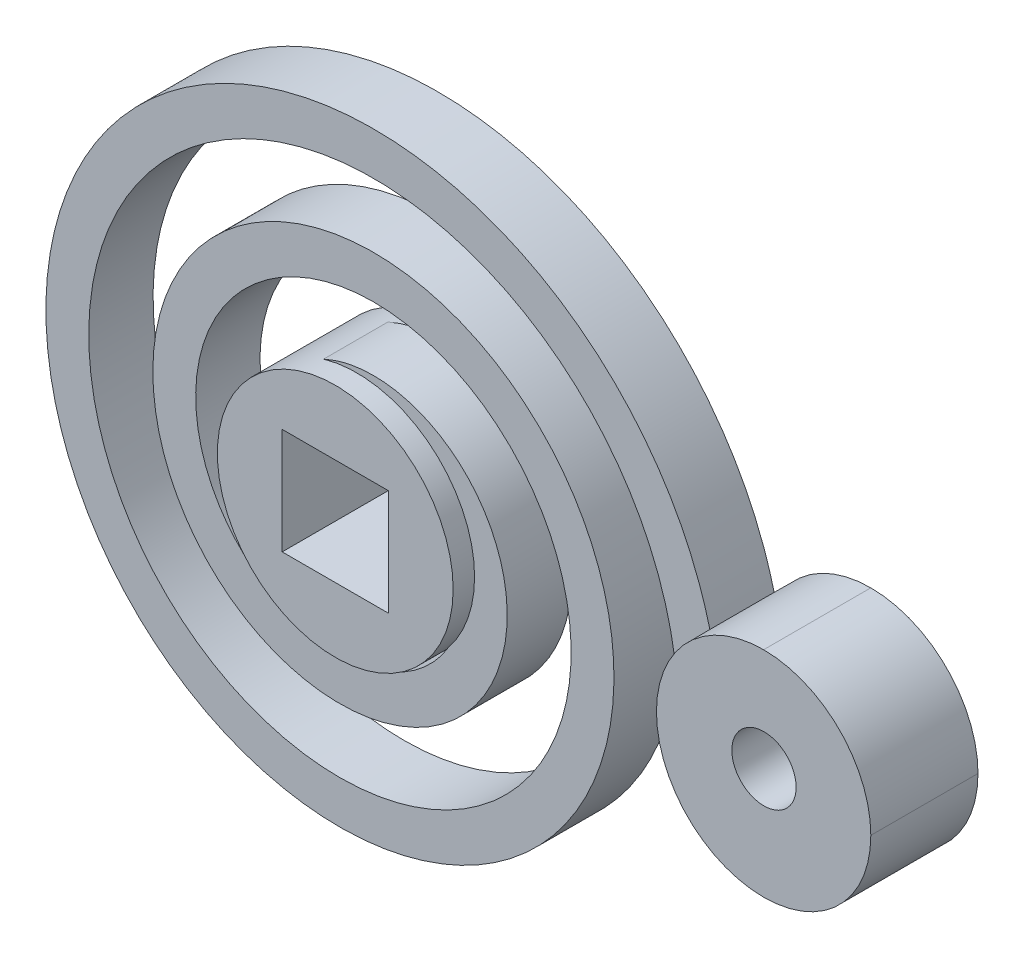
from build123d import *

# Parameters (mm, degrees)
BALAYAGE1_START  = -3
BALAYAGE1_DEPTH  = 3
ESQUISSE5_W      = 2
ESQUISSE5_H      = 3
EXTRUSION1_DEPTH = 4
ESQUISSE8_R      = 5.5
ESQUISSE8_W      = 10
ESQUISSE8_H      = 10
EXTRUSION2_DEPTH = 3
ESQUISSE9_R      = 1.5
ESQUISSE9_W      = 4.949747468
ESQUISSE9_H      = 4.949747468
EXTRUSION3_DEPTH = 30.683713673
EXTRUSION4_START = 1
ESQUISSE10_R     = 5.5
ESQUISSE10_W     = 4.949747468
ESQUISSE10_H     = 4.949747468
ESQUISSE10_W_2   = 10
ESQUISSE10_H_2   = 10
ESQUISSE10_R_2   = 1.5
EXTRUSION4_DEPTH = 1
ESQUISSE11_R     = 5.5
ESQUISSE11_W     = 4.949747468
ESQUISSE11_H     = 4.949747468
ESQUISSE11_W_2   = 10
ESQUISSE11_H_2   = 10
ESQUISSE11_R_2   = 1.5
EXTRUSION5_DEPTH = 1
CONG_1_START     = -4
CONG_1_DEPTH     = 5
CONG_1_2_DEPTH   = 1
CONG_1_3_DEPTH   = 1


with BuildPart() as part:
    # Balayage1: read off the stored shape, not the designer's step
    # Balayage1 outline → Balayage1 (new body)
    with BuildSketch(Plane.XY.offset(BALAYAGE1_START)):
        with BuildLine():
            Line((2.098663599, -0.46176203), (0.123522615, -0.776115481))
            add(Edge.make_bspline(
                [(0.123522615, -0.776115481), (0.119570945, -0.779541607), (0.116841063, -0.801624896), (0.0975614, -0.85668256), (0.079206465, -0.900433427), (0.019116685, -0.990384752), (-0.027528733, -1.045673964), (-0.148833871, -1.145674178), (-0.230781439, -1.197271691), (-0.421065415, -1.275060008), (-0.538243323, -1.305436912), (-0.790758643, -1.326771744), (-0.935598067, -1.31897245), (-1.229220073, -1.253335884), (-1.387268782, -1.193813973), (-1.688620492, -1.019723711), (-1.840120777, -0.900805212), (-2.107459984, -0.610094385), (-2.229719765, -0.431764496), (-2.418157895, -0.032288199), (-2.488450517, 0.196934301), (-2.555911758, 0.680543462), (-2.554573079, 0.943782939), (-2.467802028, 1.47147721), (-2.381161243, 1.744752711), (-2.121060571, 2.26448101), (-1.943848091, 2.518935205), (-1.509479191, 2.971801175), (-1.246401147, 3.176695335), (-0.657106892, 3.503349942), (-0.323357379, 3.62951923), (0.381344739, 3.777117066), (0.760753461, 3.800516307), (1.523625971, 3.729473328), (1.915709359, 3.634417198), (2.666460941, 3.324195536), (3.033148633, 3.105912639), (3.694926531, 2.55912899), (3.996734086, 2.225306189), (4.493840621, 1.469608999), (4.693974098, 1.040695902), (4.960043765, 0.128070209), (5.028521057, -0.363764724), (5.014307751, -1.360347881), (4.931658241, -1.873580254), (4.61158103, -2.865975608), (4.371707666, -3.353237249), (3.748391318, -4.245935559), (3.360245987, -4.658377544), (2.46646316, -5.357619951), (1.95429181, -5.649724951), (0.851952915, -6.073057278), (0.254001961, -6.207433387), (-0.969875767, -6.292747761), (-1.604148351, -6.244414658), (-2.844256393, -5.957530752), (-3.458267977, -5.717236422), (-4.600076718, -5.057175697), (-5.135167071, -4.633357133), (-6.065467866, -3.634654225), (-6.466455902, -3.053772655), (-7.084407032, -1.78543258), (-7.305134435, -1.090562799), (-7.532746496, 0.34841253), (-7.541061918, 1.100691911), (-7.332063144, 2.588948779), (-7.113730208, 3.33314777), (-6.459862064, 4.737214154), (-6.020956025, 5.404634726), (-4.954957034, 6.590878731), (-4.322442528, 7.115931984), (-2.917267116, 7.963174424), (-2.137612246, 8.289732511), (-0.501776106, 8.701331307), (0.362358472, 8.788506009), (2.093045811, 8.702728757), (2.967817072, 8.529497227), (4.641513018, 7.927111256), (5.448206615, 7.495295061), (6.910356841, 6.403524808), (7.572459382, 5.73876477), (8.680010792, 4.231076997), (9.130408706, 3.381622214), (9.76561158, 1.573173827), (9.95324376, 0.606503192), (10.035726085, -1.354509225), (9.931041877, -2.357008956), (9.426948831, -4.301461932), (9.025609686, -5.251345241), (7.952829611, -7.003776092), (7.277235745, -7.813338755), (5.706063134, -9.207749507), (4.804474226, -9.798091865), (2.853462563, -10.693548247), (1.796697699, -11.002163126), (-0.376105069, -11.296732523), (-1.500177774, -11.283895775), (-3.709980792, -10.925568218), (-4.803740998, -10.578894532), (-6.854724832, -9.572361265), (-7.819278008, -8.909034981), (-9.521935421, -7.317542409), (-10.266035733, -6.383930779), (-11.454604136, -4.3258554), (-11.903218608, -3.194443355), (-12.45160679, -0.834708368), (-12.553322213, 0.401461217), (-12.388017152, 2.864527266), (-12.12057028, 4.099487786), (-11.22923579, 6.450809979), (-10.602595453, 7.574754921), (-9.03742655, 9.601290037), (-8.094061797, 10.510327624), (-5.969408245, 12.02032189), (-4.781622291, 12.626034709), (-2.265903389, 13.467024105), (-0.930377516, 13.704957558), (1.76716748, 13.778832184), (3.137216572, 13.615105325), (5.783909405, 12.888773647), (7.068325029, 12.324151677), (9.428118855, 10.834695215), (10.510339467, 9.905673332), (12.364847373, 7.759349174), (13.142457911, 6.536055333), (14.311068079, 3.901043082), (14.705414555, 2.482050155), (15.062646927, -0.424595604), (15.026622205, -1.920145212), (14.770844841, -3.385270744)],
                knots=[0, 0, 0, 0, 0.015625, 0.015625, 0.03125, 0.03125, 0.046875, 0.046875, 0.0625, 0.0625, 0.078125, 0.078125, 0.09375, 0.09375, 0.109375, 0.109375, 0.125, 0.125, 0.140625, 0.140625, 0.15625, 0.15625, 0.171875, 0.171875, 0.1875, 0.1875, 0.203125, 0.203125, 0.21875, 0.21875, 0.234375, 0.234375, 0.25, 0.25, 0.265625, 0.265625, 0.28125, 0.28125, 0.296875, 0.296875, 0.3125, 0.3125, 0.328125, 0.328125, 0.34375, 0.34375, 0.359375, 0.359375, 0.375, 0.375, 0.390625, 0.390625, 0.40625, 0.40625, 0.421875, 0.421875, 0.4375, 0.4375, 0.453125, 0.453125, 0.46875, 0.46875, 0.484375, 0.484375, 0.5, 0.5, 0.515625, 0.515625, 0.53125, 0.53125, 0.546875, 0.546875, 0.5625, 0.5625, 0.578125, 0.578125, 0.59375, 0.59375, 0.609375, 0.609375, 0.625, 0.625, 0.640625, 0.640625, 0.65625, 0.65625, 0.671875, 0.671875, 0.6875, 0.6875, 0.703125, 0.703125, 0.71875, 0.71875, 0.734375, 0.734375, 0.75, 0.75, 0.765625, 0.765625, 0.78125, 0.78125, 0.796875, 0.796875, 0.8125, 0.8125, 0.828125, 0.828125, 0.84375, 0.84375, 0.859375, 0.859375, 0.875, 0.875, 0.890625, 0.890625, 0.90625, 0.90625, 0.921875, 0.921875, 0.9375, 0.9375, 0.953125, 0.953125, 0.96875, 0.96875, 0.984375, 0.984375, 1, 1, 1, 1], degree=3))
            Line((14.770844841, -3.385270744), (16.748248511, -3.685061879))
            add(Edge.make_bspline(
                [(2.098663599, -0.46176203), (2.129630148, -0.684585885), (2.124981067, -0.923442707), (2.032372753, -1.408017477), (1.944357309, -1.653637163), (1.681879935, -2.122339402), (1.507396908, -2.345307697), (1.079148696, -2.738502757), (0.825401597, -2.908611426), (0.25614759, -3.16862501), (-0.059302074, -3.25842113), (-0.725219387, -3.336556884), (-1.075594964, -3.32480968), (-1.777671245, -3.187808192), (-2.129253363, -3.062499824), (-2.796304814, -2.697687681), (-3.111640586, -2.458170298), (-3.668857568, -1.876659015), (-3.910603908, -1.534695699), (-4.287488846, -0.772173533), (-4.422505689, -0.35168863), (-4.560882855, 0.533413521), (-4.564148235, 0.997918916), (-4.425388678, 1.928836294), (-4.283307124, 2.395108212), (-3.853955788, 3.283399666), (-3.566675767, 3.705264013), (-2.861798087, 4.459140797), (-2.444240189, 4.790998192), (-1.508011543, 5.324545488), (-0.989429201, 5.526096466), (0.107246046, 5.768480082), (0.685208295, 5.809204987), (1.849965689, 5.712914668), (2.436598914, 5.575835505), (3.563389104, 5.123070388), (4.103367543, 4.807373056), (5.082083612, 4.013821808), (5.520643115, 3.536012968), (6.247728365, 2.451509539), (6.536094129, 1.844914914), (6.925119862, 0.550740613), (7.025654742, -0.136691305), (7.016814166, -1.533764336), (6.907362573, -2.243222035), (6.47488662, -3.619722817), (6.151844946, -4.286563016), (5.308506267, -5.513226761), (4.78825532, -6.072846763), (3.586375818, -7.026670398), (2.904855264, -7.420689522), (1.433548891, -7.997019971), (0.643925514, -8.179184523), (-0.97733681, -8.302669946), (-1.808771957, -8.243897631), (-3.439827853, -7.877191544), (-4.23922106, -7.569229534), (-5.731333916, -6.718507483), (-6.423822908, -6.175789759), (-7.633203283, -4.892405344), (-8.149882667, -4.151850618), (-8.95138808, -2.529799829), (-9.236041646, -1.648477802), (-9.535761532, 0.182272453), (-9.550712884, 1.131478345), (-9.296199226, 3.015345563), (-9.026689972, 3.949755139), (-8.213767995, 5.718760713), (-7.670388822, 6.553097944), (-6.345763661, 8.0418278), (-5.564629037, 8.695978556), (-3.823870373, 9.75695395), (-2.864428233, 10.163576853), (-0.845333633, 10.681614692), (0.214080538, 10.792888374), (2.342309281, 10.697071429), (3.410849113, 10.489915481), (5.46177438, 9.761965032), (6.443872679, 9.241190079), (8.230148699, 7.919324843), (9.034052951, 7.11834035), (10.384483216, 5.296092615), (10.930775147, 4.275014832), (11.706551085, 2.094924245), (11.935863368, 0.936162398), (12.044457026, -1.421260098), (11.923647036, -2.619625001), (11.3289944, -4.950819408), (10.855151951, -6.083333913), (9.583059171, -8.17926816), (8.784903756, -9.142381809), (6.923012596, -10.807265762), (5.859461049, -11.508767149), (3.551588111, -12.578230665), (2.307526403, -12.945986834), (-0.25729886, -13.303042975), (-1.577748397, -13.292220788), (-4.180725436, -12.879483778), (-5.462911367, -12.477544444), (-7.874132319, -11.304465597), (-9.002828349, -10.533404592), (-11.001571984, -8.67770551), (-11.871314001, -7.593245109), (-13.26617953, -5.196231204), (-13.791059582, -3.883941553), (-14.438109518, -1.139926653), (-14.560122009, 0.291469773), (-14.377328689, 3.150854227), (-14.072468392, 4.578476193), (-13.04904344, 7.303825942), (-12.330535215, 8.601182345), (-10.530143415, 10.947070634), (-9.448425381, 11.995259143), (-7.005809409, 13.742296031), (-5.645174401, 14.440860776), (-2.756299599, 15.416082195), (-1.228399282, 15.692542216), (1.865183386, 15.786244103), (3.430478047, 15.603396444), (6.461810962, 14.780797253), (7.927446768, 14.14107437), (10.627202402, 12.447610857), (11.860940713, 11.394017754), (13.981328239, 8.953619846), (14.867651634, 7.56707148), (16.205073248, 4.573376393), (16.655932023, 2.966575004), (17.070324415, -0.332325267), (17.033728693, -2.024018404), (16.748248511, -3.685061879)],
                knots=[0, 0, 0, 0, 0.015625, 0.015625, 0.03125, 0.03125, 0.046875, 0.046875, 0.0625, 0.0625, 0.078125, 0.078125, 0.09375, 0.09375, 0.109375, 0.109375, 0.125, 0.125, 0.140625, 0.140625, 0.15625, 0.15625, 0.171875, 0.171875, 0.1875, 0.1875, 0.203125, 0.203125, 0.21875, 0.21875, 0.234375, 0.234375, 0.25, 0.25, 0.265625, 0.265625, 0.28125, 0.28125, 0.296875, 0.296875, 0.3125, 0.3125, 0.328125, 0.328125, 0.34375, 0.34375, 0.359375, 0.359375, 0.375, 0.375, 0.390625, 0.390625, 0.40625, 0.40625, 0.421875, 0.421875, 0.4375, 0.4375, 0.453125, 0.453125, 0.46875, 0.46875, 0.484375, 0.484375, 0.5, 0.5, 0.515625, 0.515625, 0.53125, 0.53125, 0.546875, 0.546875, 0.5625, 0.5625, 0.578125, 0.578125, 0.59375, 0.59375, 0.609375, 0.609375, 0.625, 0.625, 0.640625, 0.640625, 0.65625, 0.65625, 0.671875, 0.671875, 0.6875, 0.6875, 0.703125, 0.703125, 0.71875, 0.71875, 0.734375, 0.734375, 0.75, 0.75, 0.765625, 0.765625, 0.78125, 0.78125, 0.796875, 0.796875, 0.8125, 0.8125, 0.828125, 0.828125, 0.84375, 0.84375, 0.859375, 0.859375, 0.875, 0.875, 0.890625, 0.890625, 0.90625, 0.90625, 0.921875, 0.921875, 0.9375, 0.9375, 0.953125, 0.953125, 0.96875, 0.96875, 0.984375, 0.984375, 1, 1, 1, 1], degree=3))
        make_face()
    extrude(amount=BALAYAGE1_DEPTH)

    # Esquisse5 → Extrusion1 (add)
    with BuildSketch(Plane(origin=(0.123522615, -0.776115481, 0), x_dir=(0.9875704921513923, 0.15717672547758813, 0), z_dir=(-0.15717672547758813, 0.9875704921513923, 0))):
        with Locations((1, 1.5)):
            Rectangle(ESQUISSE5_W, ESQUISSE5_H)
    extrude(amount=EXTRUSION1_DEPTH)

    # Esquisse8 → Extrusion2 (add)
    with BuildSketch(Plane.XY):
        Circle(ESQUISSE8_R)
        with Locations((19.983367447, -0.197740643)):
            Rectangle(ESQUISSE8_W, ESQUISSE8_H)
    extrude(amount=-EXTRUSION2_DEPTH)

    # Esquisse9 → Extrusion3 (cut, through all)
    with BuildSketch(Plane.XY):
        with Locations((20, 0)):
            Circle(ESQUISSE9_R)
        Rectangle(ESQUISSE9_W, ESQUISSE9_H)
    extrude(amount=-EXTRUSION3_DEPTH, mode=Mode.SUBTRACT)

    # Esquisse10 → Extrusion4 (add)
    # profile 1 of 2: a face of its own
    with BuildSketch(Plane.XY.offset(EXTRUSION4_START)):
        Circle(ESQUISSE10_R)
        Rectangle(ESQUISSE10_W, ESQUISSE10_H, mode=Mode.SUBTRACT)
    # profile 2 of 2: a face of its own
    with BuildSketch(Plane.XY.offset(EXTRUSION4_START)):
        with Locations((19.983367447, -0.197740643)):
            Rectangle(ESQUISSE10_W_2, ESQUISSE10_H_2)
        with Locations((20, 0)):
            Circle(ESQUISSE10_R_2, mode=Mode.SUBTRACT)
    extrude(amount=-EXTRUSION4_DEPTH)

    # Esquisse11 → Extrusion5 (add)
    # profile 1 of 2: a face of its own
    with BuildSketch(Plane(origin=(0, 0, -3), x_dir=(-1, 0, 0), z_dir=(0, 0, -1))):
        with Locations(Location((0, 0, 0), (0, 0, 180))):
            Circle(ESQUISSE11_R)
        Rectangle(ESQUISSE11_W, ESQUISSE11_H, mode=Mode.SUBTRACT)
    # profile 2 of 2: a face of its own
    with BuildSketch(Plane(origin=(0, 0, -3), x_dir=(-1, 0, 0), z_dir=(0, 0, -1))):
        with Locations((-19.983367447, -0.197740643)):
            Rectangle(ESQUISSE11_W_2, ESQUISSE11_H_2)
        with Locations(Location((-20, 0, 0), (0, 0, 180))):
            Circle(ESQUISSE11_R_2, mode=Mode.SUBTRACT)
    extrude(amount=EXTRUSION5_DEPTH)

    # Congé1: read off the stored shape, not the designer's step
    # Congé1 outline → Congé1 (cut)
    with BuildSketch(Plane.XY.offset(CONG_1_START)):
        with BuildLine():
            add(Edge.make_bspline(
                [(14.992186541, -0.494579252), (14.998087204, -0.792229926), (14.995161541, -1.090575848), (14.983367447, -1.389018627)],
                knots=[0.989790442, 0.989790442, 0.989790442, 0.989790442, 0.992945946, 0.992945946, 0.992945946, 0.992945946], degree=3))
            ThreePointArc((14.992186541, -0.494579252), (14.985572707, -0.346225437), (14.983367447, -0.197740643))
            Line((14.983367447, -0.197740643), (14.983367447, -1.389018627))
        make_face()
        with BuildLine():
            ThreePointArc((19.983367447, -5.197740643), (17.999440572, -4.787297719), (16.341229196, -3.623354305))
            Line((16.341229196, -3.623354305), (14.983367447, -3.41749097))
            Line((14.983367447, -3.41749097), (14.983367447, -5.197740643))
            Line((14.983367447, -5.197740643), (19.983367447, -5.197740643))
        make_face()
        with BuildLine():
            add(Edge.make_bspline(
                [(16.041437874, 4.802259357), (16.207139519, 4.331087868), (16.352119562, 3.851507436), (16.475656645, 3.365399114)],
                knots=[0.973078812, 0.973078812, 0.973078812, 0.973078812, 0.977820553, 0.977820553, 0.977820553, 0.977820553], degree=3))
            ThreePointArc((16.475656645, 3.365399114), (18.088070476, 4.429121078), (19.983367447, 4.802259357))
            Line((19.983367447, 4.802259357), (16.041437874, 4.802259357))
        make_face()
        with BuildLine():
            ThreePointArc((24.983367447, -0.197740643), (23.518901353, -3.733274549), (19.983367447, -5.197740643))
            Line((19.983367447, -5.197740643), (24.983367447, -5.197740643))
            Line((24.983367447, -5.197740643), (24.983367447, -0.197740643))
        make_face()
        with BuildLine():
            Line((24.983367447, 4.802259357), (19.983367447, 4.802259357))
            ThreePointArc((19.983367447, 4.802259357), (23.518901352, 3.337793263), (24.983367447, -0.197740643))
            Line((24.983367447, -0.197740643), (24.983367447, 4.802259357))
        make_face()
    extrude(amount=CONG_1_DEPTH, mode=Mode.SUBTRACT)

    # Cong_1 2 outline → Cong_1 2 (cut)
    with BuildSketch(Plane.XY.offset(CONG_1_START)):
        with BuildLine():
            ThreePointArc((16.341229196, -3.623354305), (15.39197787, -2.177422878), (14.992186541, -0.494579252))
            add(Edge.make_bspline(
                [(14.992186541, -0.494579252), (14.998087204, -0.792229926), (14.995161541, -1.090575848), (14.983367447, -1.389018627)],
                knots=[0.989790442, 0.989790442, 0.989790442, 0.989790442, 0.992945946, 0.992945946, 0.992945946, 0.992945946], degree=3))
            Line((14.983367447, -1.389018627), (14.983367447, -3.417490971))
            Line((14.983367447, -3.417490971), (16.341229196, -3.623354305))
        make_face()
        with BuildLine():
            Line((14.983367447, 4.802259357), (14.983367447, -0.197740643))
            ThreePointArc((14.983367447, -0.197740643), (15.371504808, 1.733767315), (16.475656645, 3.365399114))
            add(Edge.make_bspline(
                [(16.041437874, 4.802259357), (16.207139519, 4.331087868), (16.352119562, 3.851507436), (16.475656645, 3.365399114)],
                knots=[0.973078812, 0.973078812, 0.973078812, 0.973078812, 0.977820553, 0.977820553, 0.977820553, 0.977820553], degree=3))
            Line((16.041437874, 4.802259357), (14.983367447, 4.802259357))
        make_face()
    extrude(amount=CONG_1_2_DEPTH, mode=Mode.SUBTRACT)

    # Cong_1 3 outline → Cong_1 3 (cut)
    with BuildSketch(Plane.XY):
        with BuildLine():
            ThreePointArc((16.341229196, -3.623354305), (15.39197787, -2.177422878), (14.992186541, -0.494579252))
            add(Edge.make_bspline(
                [(14.992186541, -0.494579252), (14.998087204, -0.792229926), (14.995161541, -1.090575848), (14.983367447, -1.389018627)],
                knots=[0.989790442, 0.989790442, 0.989790442, 0.989790442, 0.992945946, 0.992945946, 0.992945946, 0.992945946], degree=3))
            Line((14.983367447, -1.389018627), (14.983367447, -3.417490971))
            Line((14.983367447, -3.417490971), (16.341229196, -3.623354305))
        make_face()
        with BuildLine():
            Line((14.983367447, 4.802259357), (14.983367447, -0.197740643))
            ThreePointArc((14.983367447, -0.197740643), (15.371504808, 1.733767315), (16.475656645, 3.365399114))
            add(Edge.make_bspline(
                [(16.041437874, 4.802259357), (16.207139519, 4.331087868), (16.352119562, 3.851507436), (16.475656645, 3.365399114)],
                knots=[0.973078812, 0.973078812, 0.973078812, 0.973078812, 0.977820553, 0.977820553, 0.977820553, 0.977820553], degree=3))
            Line((16.041437874, 4.802259357), (14.983367447, 4.802259357))
        make_face()
    extrude(amount=CONG_1_3_DEPTH, mode=Mode.SUBTRACT)


solid = part.part
